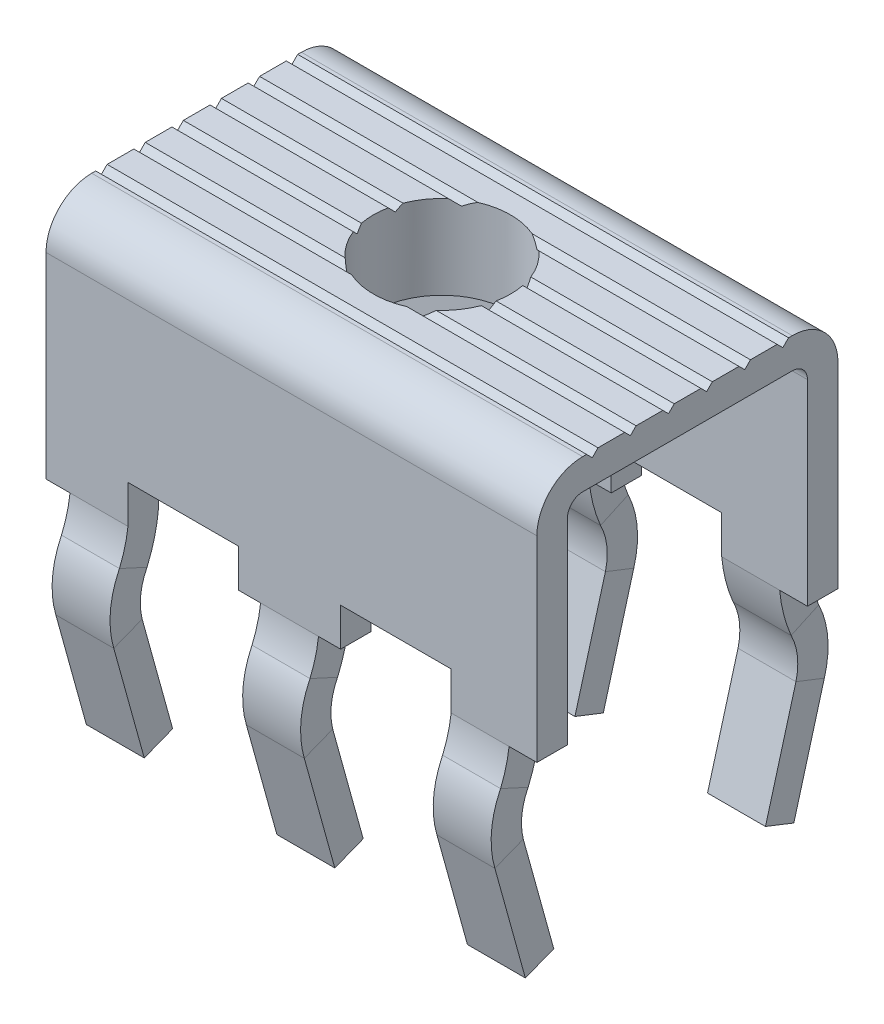
from build123d import *

# Parameters (mm, degrees)
BOSS_EXTRUDE1_DEPTH     = 12.88
SWEEP1_START            = 0.63
SWEEP1_DEPTH            = 1.52
LPATTERN1_COUNT         = 3
LPATTERN1_PITCH         = 5
SKETCH5_W               = 2.9
SKETCH5_H               = 0.8
CUT_EXTRUDE1_DEPTH      = 1
LPATTERN2_COUNT         = 2
LPATTERN2_PITCH         = 5.58
MIRROR1_START           = 0.63
MIRROR1_COPY_1_DEPTH    = 1.52
MIRROR1_COPY_2_DEPTH    = 1.52
MIRROR1_COPY_3_SKETCH_W = 2.9
MIRROR1_COPY_3_SKETCH_H = 0.8
MIRROR1_COPY_3_DEPTH    = 1
CUT_EXTRUDE2_REACH      = 21.386
SKETCH6_R               = 1.8
SKETCH7_R               = 2.2
SKETCH7_R_2             = 1.8
BOSS_EXTRUDE2_DEPTH     = 1.4
CUT_EXTRUDE3_DEPTH      = 17.621667755


# Read off the part's stored shape, not the designer's step: Sweep1
with BuildPart() as part:
    # Sketch1 → Boss-Extrude1 (new body)
    with BuildSketch(Plane(origin=(0, 0, 0), x_dir=(0, 0, -1), z_dir=(1, 0, 0))):
        with BuildLine():
            Line((0, 0), (0, 5.15))
            ThreePointArc((0, 5.15), (0.351471863, 5.998528137), (1.2, 6.35))
            Line((1.2, 6.35), (6.7, 6.35))
            ThreePointArc((6.7, 6.35), (7.548528137, 5.998528137), (7.9, 5.15))
            Line((7.9, 5.15), (7.9, 0))
            Line((7.9, 0), (7.1, 0))
            Line((7.1, 0), (7.1, 5.15))
            ThreePointArc((7.1, 5.15), (6.982842712, 5.432842712), (6.7, 5.55))
            Line((6.7, 5.55), (1.2, 5.55))
            ThreePointArc((1.2, 5.55), (0.917157288, 5.432842712), (0.8, 5.15))
            Line((0.8, 5.15), (0.8, 0))
            Line((0.8, 0), (0, 0))
        make_face()
    extrude(amount=BOSS_EXTRUDE1_DEPTH)

    # Sweep1 outline → Sweep1 (add)
    with BuildSketch(Plane.YZ.offset(SWEEP1_START)):
        with BuildLine():
            add(Edge.make_bspline(
                [(-0.846283759, -8.124029358), (-0.858016898, -8.129757785), (-0.870152204, -8.135642842), (-1.003345202, -8.19967658), (-1.15196737, -8.253874655), (-1.433217357, -8.328196696), (-1.577221625, -8.352525408), (-2.012213537, -8.385830326), (-2.305250753, -8.352541538), (-2.584692284, -8.272379972)],
                knots=[-0.008659355, -0.008659355, -0.008659355, -0.008659355, 0, 0, 0.081660017, 0.081660017, 0.163320034, 0.163320034, 0.326640068, 0.326640068, 0.326640068, 0.326640068], degree=3))
            ThreePointArc((-0.846283759, -8.124029358), (-0.431086788, -7.982015265), (0, -7.9))
            Line((0, -7.9), (0, -7.1))
            add(Edge.make_bspline(
                [(0, -7.1), (-0.377073857, -7.135252748), (-0.796992874, -7.239007705), (-1.153651992, -7.390208706), (-1.166116228, -7.395524363), (-1.178338095, -7.400759688)],
                knots=[0, 0, 0, 0, 1, 1, 1.037382886, 1.037382886, 1.037382886, 1.037382886], degree=3))
            ThreePointArc((-1.178338095, -7.400759688), (-1.724000867, -7.564826814), (-2.292574798, -7.527620028))
            Line((-2.292574798, -7.527620028), (-5.183941257, -6.727620028))
            Line((-5.183941257, -6.727620028), (-5.476058743, -7.472379972))
            Line((-5.476058743, -7.472379972), (-2.584692284, -8.272379972))
        make_face()
    sweep1 = extrude(amount=SWEEP1_DEPTH)

    # LPattern1: Sweep1 ×3
    with Locations(*[(i * LPATTERN1_PITCH, 0, 0) for i in range(1, LPATTERN1_COUNT)]):
        add(sweep1)

    # Sketch5 → Cut-Extrude1 (cut)
    with BuildSketch(Plane.XZ):
        with Locations((3.6, -7.5)):
            Rectangle(SKETCH5_W, SKETCH5_H)
    cut_extrude1 = extrude(amount=-CUT_EXTRUDE1_DEPTH, mode=Mode.SUBTRACT)

    # LPattern2: Cut-Extrude1 ×2
    with Locations(*[(i * LPATTERN2_PITCH, 0, 0) for i in range(1, LPATTERN2_COUNT)]):
        add(cut_extrude1, mode=Mode.SUBTRACT)

    # Mirror1: Sweep1, Cut-Extrude1 across plane
    add(sweep1.mirror(Plane(origin=(0, 0, -3.95), x_dir=(1, 0, 0), z_dir=(0, 0, -1))))
    add(cut_extrude1.mirror(Plane(origin=(0, 0, -3.95), x_dir=(1, 0, 0), z_dir=(0, 0, -1))), mode=Mode.SUBTRACT)

    # Mirror1 copy 1 sketch → Mirror1 copy 1 (add)
    with BuildSketch(Plane(origin=(5, 0, -7.9), x_dir=(0, 1, 0), z_dir=(1, 0, 0)).offset(MIRROR1_START)):
        with BuildLine():
            add(Edge.make_bspline(
                [(-0.846283759, 8.124029358), (-0.858016898, 8.129757785), (-0.870152204, 8.135642842), (-1.003345202, 8.19967658), (-1.15196737, 8.253874655), (-1.433217357, 8.328196696), (-1.577221625, 8.352525408), (-2.012213537, 8.385830326), (-2.305250753, 8.352541538), (-2.584692284, 8.272379972)],
                knots=[-0.008659355, -0.008659355, -0.008659355, -0.008659355, 0, 0, 0.081660017, 0.081660017, 0.163320034, 0.163320034, 0.326640068, 0.326640068, 0.326640068, 0.326640068], degree=3))
            ThreePointArc((-0.846283759, 8.124029358), (-0.431086788, 7.982015265), (0, 7.9))
            Line((0, 7.9), (0, 7.1))
            add(Edge.make_bspline(
                [(0, 7.1), (-0.377073857, 7.135252748), (-0.796992874, 7.239007705), (-1.153651992, 7.390208706), (-1.166116228, 7.395524363), (-1.178338095, 7.400759688)],
                knots=[0, 0, 0, 0, 1, 1, 1.037382886, 1.037382886, 1.037382886, 1.037382886], degree=3))
            ThreePointArc((-1.178338095, 7.400759688), (-1.724000867, 7.564826814), (-2.292574798, 7.527620028))
            Line((-2.292574798, 7.527620028), (-5.183941257, 6.727620028))
            Line((-5.183941257, 6.727620028), (-5.476058743, 7.472379972))
            Line((-5.476058743, 7.472379972), (-2.584692284, 8.272379972))
        make_face()
    extrude(amount=MIRROR1_COPY_1_DEPTH)

    # Mirror1 copy 2 sketch → Mirror1 copy 2 (add)
    with BuildSketch(Plane(origin=(10, 0, -7.9), x_dir=(0, 1, 0), z_dir=(1, 0, 0)).offset(MIRROR1_START)):
        with BuildLine():
            add(Edge.make_bspline(
                [(-0.846283759, 8.124029358), (-0.858016898, 8.129757785), (-0.870152204, 8.135642842), (-1.003345202, 8.19967658), (-1.15196737, 8.253874655), (-1.433217357, 8.328196696), (-1.577221625, 8.352525408), (-2.012213537, 8.385830326), (-2.305250753, 8.352541538), (-2.584692284, 8.272379972)],
                knots=[-0.008659355, -0.008659355, -0.008659355, -0.008659355, 0, 0, 0.081660017, 0.081660017, 0.163320034, 0.163320034, 0.326640068, 0.326640068, 0.326640068, 0.326640068], degree=3))
            ThreePointArc((-0.846283759, 8.124029358), (-0.431086788, 7.982015265), (0, 7.9))
            Line((0, 7.9), (0, 7.1))
            add(Edge.make_bspline(
                [(0, 7.1), (-0.377073857, 7.135252748), (-0.796992874, 7.239007705), (-1.153651992, 7.390208706), (-1.166116228, 7.395524363), (-1.178338095, 7.400759688)],
                knots=[0, 0, 0, 0, 1, 1, 1.037382886, 1.037382886, 1.037382886, 1.037382886], degree=3))
            ThreePointArc((-1.178338095, 7.400759688), (-1.724000867, 7.564826814), (-2.292574798, 7.527620028))
            Line((-2.292574798, 7.527620028), (-5.183941257, 6.727620028))
            Line((-5.183941257, 6.727620028), (-5.476058743, 7.472379972))
            Line((-5.476058743, 7.472379972), (-2.584692284, 8.272379972))
        make_face()
    extrude(amount=MIRROR1_COPY_2_DEPTH)

    # Mirror1 copy 3 sketch → Mirror1 copy 3 (cut)
    with BuildSketch(Plane(origin=(5.58, 0, -7.9), x_dir=(1, 0, 0), z_dir=(0, -1, 0))):
        with Locations((3.6, 7.5)):
            Rectangle(MIRROR1_COPY_3_SKETCH_W, MIRROR1_COPY_3_SKETCH_H)
    extrude(amount=-MIRROR1_COPY_3_DEPTH, mode=Mode.SUBTRACT)

    # Sketch6 → Cut-Extrude2 (cut, up to next)
    with BuildSketch(Plane(origin=(0, 6.35, 0), x_dir=(1, 0, 0), z_dir=(0, 1, 0)), mode=Mode.PRIVATE) as cut_extrude2_sk1:
        with Locations(Location((6.44, 3.95, 0), (0, 0, 270))):
            Circle(SKETCH6_R)
    cut_extrude2_tool1 = extrude(cut_extrude2_sk1.sketch, amount=-CUT_EXTRUDE2_REACH, mode=Mode.PRIVATE) & part.part
    add(cut_extrude2_tool1.solids().sort_by_distance((6.44, 6.35, -3.95))[0], mode=Mode.SUBTRACT)

    # Sketch7 → Boss-Extrude2 (add)
    with BuildSketch(Plane.XZ.offset(-5.55)):
        with Locations(Location((6.44, -3.95, 0), (0, 0, 90))):
            Circle(SKETCH7_R)
        with Locations(Location((6.44, -3.95, 0), (0, 0, 90))):
            Circle(SKETCH7_R_2, mode=Mode.SUBTRACT)
    extrude(amount=BOSS_EXTRUDE2_DEPTH)

    # Sketch8 → Cut-Extrude3 (cut, through all)
    with BuildSketch(Plane.ZY):
        Polygon((-6.603043073, 6.35), (-6.453043073, 6.2), (-6.303043073, 6.35), align=None)
        Polygon((-5.303043073, 6.35), (-5.603043073, 6.35), (-5.453043073, 6.2), align=None)
        Polygon((-4.303043073, 6.35), (-4.603043073, 6.35), (-4.453043073, 6.2), align=None)
        Polygon((-3.303043073, 6.35), (-3.603043073, 6.35), (-3.453043073, 6.2), align=None)
        Polygon((-2.303043073, 6.35), (-2.603043073, 6.35), (-2.453043073, 6.2), align=None)
        Polygon((-1.303043073, 6.35), (-1.603043073, 6.35), (-1.453043073, 6.2), align=None)
    extrude(amount=-CUT_EXTRUDE3_DEPTH, mode=Mode.SUBTRACT)


solid = part.part
